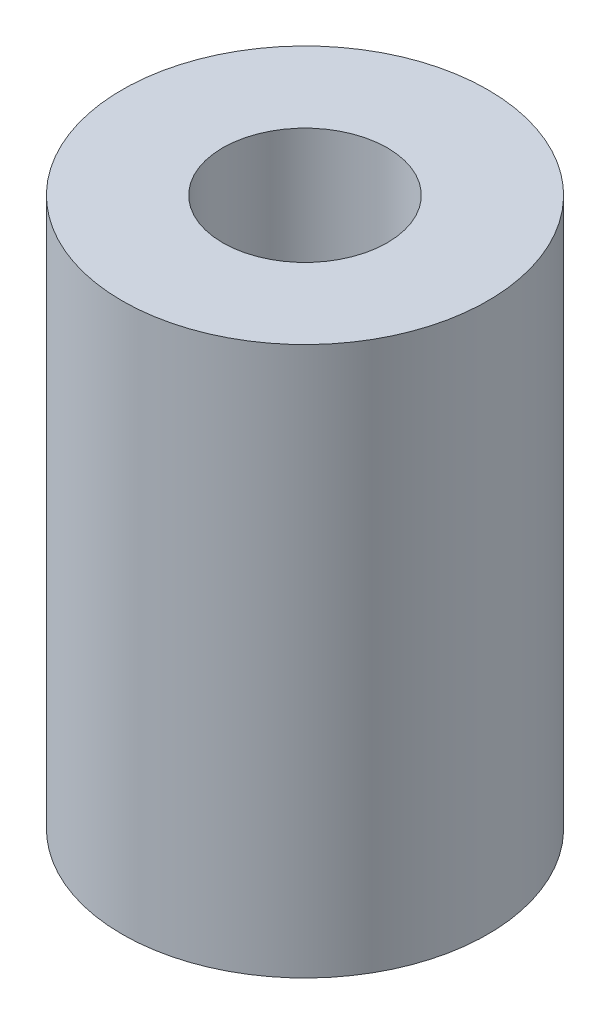
from build123d import *

# Parameters (mm, degrees)
ESQUISSE1_W = 2.75
ESQUISSE1_H = 15


with BuildPart() as part:
    # Esquisse1 → Base-Révolution (revolve)
    with BuildSketch(Plane.XY):
        with Locations((3.625, 7.5)):
            Rectangle(ESQUISSE1_W, ESQUISSE1_H)
    revolve(axis=Axis((0, 0, 0), (0, 1, 0)))


solid = part.part
